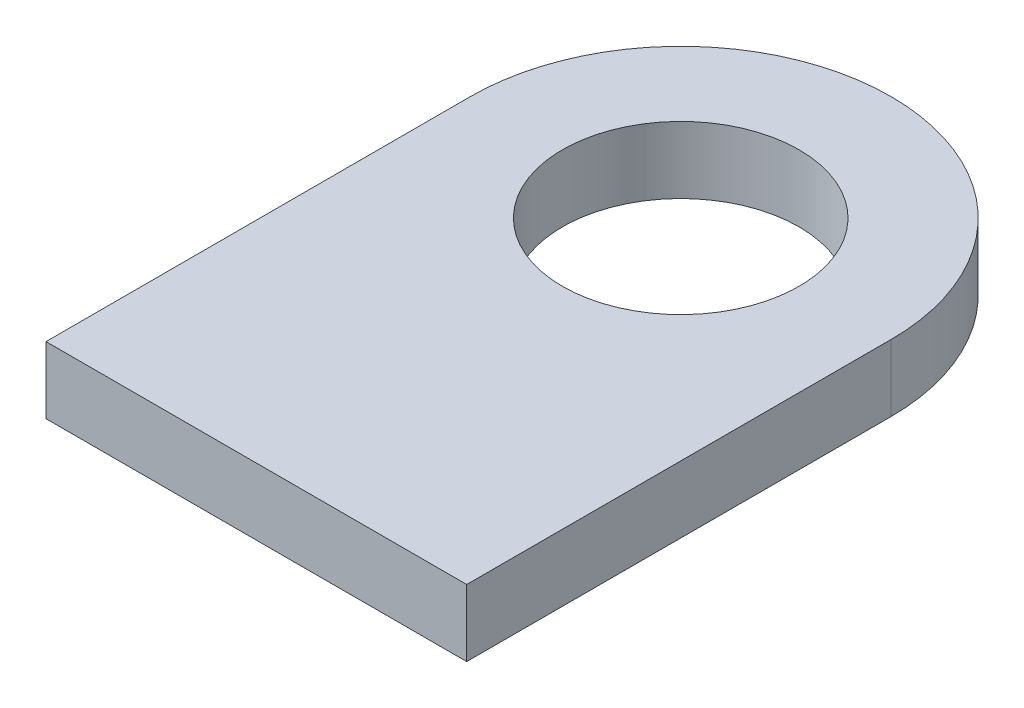
from build123d import *

# Parameters (mm, degrees)
ESBO_O1_R          = 22.5
FLANGE_BASE1_DEPTH = 12.7


# Sheet-metal steps are written as plain solids
with BuildPart() as part:
    # Esboço1 → Flange-base1 (new body)
    with BuildSketch(Plane(origin=(0, 0, 0), x_dir=(1, 0, 0), z_dir=(0, 1, 0))):
        with BuildLine():
            Line((-40, 0), (40, 0))
            Line((40, 0), (40, 80.7))
            ThreePointArc((40, 80.7), (0, 120.7), (-40, 80.7))
            Line((-40, 80.7), (-40, 0))
        make_face()
        with Locations(Location((0, 80.7, 0), (0, 0, 270))):
            Circle(ESBO_O1_R, mode=Mode.SUBTRACT)
    extrude(amount=-FLANGE_BASE1_DEPTH)


solid = part.part
